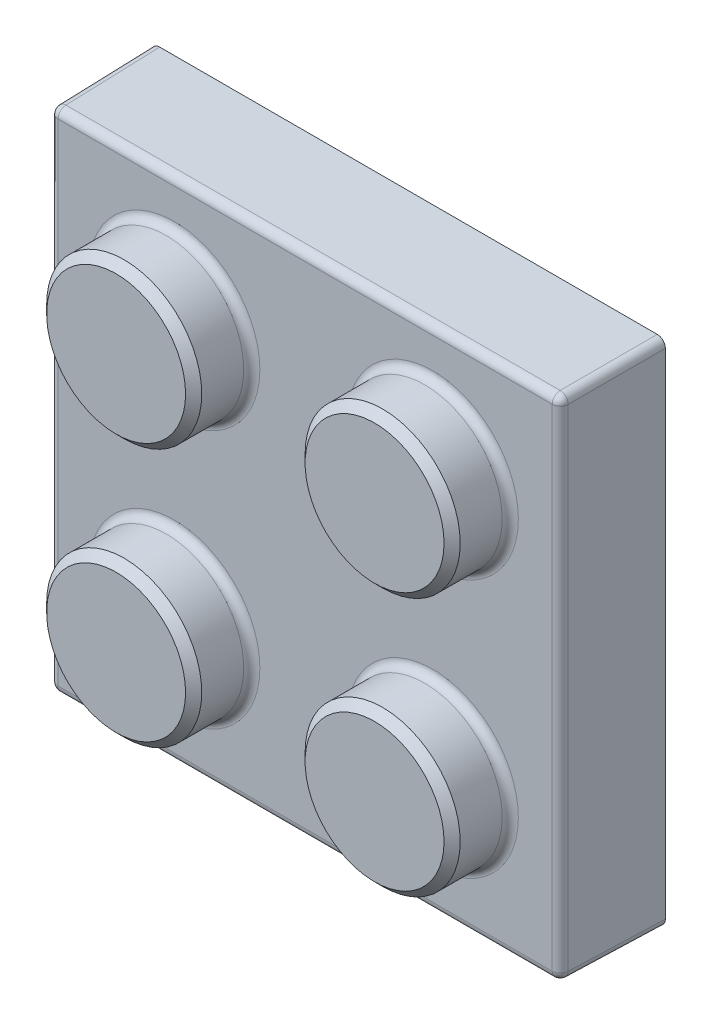
from build123d import *

# Parameters (mm, degrees)
SKETCH1_W                  = 15.9
SKETCH1_H                  = 15.8
BOSS_EXTRUDE1_DEPTH        = 3.2
BOSS_EXTRUDE1_TAPER        = 1
SKETCH2_R                  = 2.4
BOSS_EXTRUDE2_DEPTH        = 1.8
CHAMFER3_SIZE              = 0.25
LPATTERN2_COUNT            = 2
LPATTERN2_PITCH            = 8
LPATTERN2_COUNT_DIR2       = 2
LPATTERN2_PITCH_DIR2       = 8
CHAMFER3_OF_LPATTERN2_SIZE = 0.25
SHELL1_OUTLINE_R           = 1.2
SHELL1_DEPTH               = 3.8
FILLET2_R                  = 0.25


with BuildPart() as part:
    # Sketch1 → Boss-Extrude1 (new body)
    with BuildSketch(Plane.XY):
        Rectangle(SKETCH1_W, SKETCH1_H)
    extrude(amount=BOSS_EXTRUDE1_DEPTH, taper=BOSS_EXTRUDE1_TAPER)

    # Sketch2 → Boss-Extrude2 (add)
    with BuildSketch(Plane.XY.offset(3.2)):
        with Locations(Location((-4.05, -4, 0), (0, 0, 180))):
            Circle(SKETCH2_R)
    boss_extrude2 = extrude(amount=BOSS_EXTRUDE2_DEPTH)

    # Chamfer3
    chamfer3_edges = [part.edges().sort_by_distance(p)[0] for p in [
        (-1.65, -4, 5),
    ]]
    chamfer(chamfer3_edges, length=CHAMFER3_SIZE)

    # LPattern2: Boss-Extrude2 2 × 2
    with Locations(*[(j * LPATTERN2_PITCH_DIR2, i * LPATTERN2_PITCH, 0) for i in range(LPATTERN2_COUNT) for j in range(LPATTERN2_COUNT_DIR2) if (i, j) != (0, 0)]):
        add(boss_extrude2)

    # Chamfer3 of LPattern2
    chamfer3_of_lpattern2_edges = [part.edges().sort_by_distance(p)[0] for p in [
        (6.35, -4, 5),
        (-1.65, 4, 5),
        (6.35, 4, 5),
    ]]
    chamfer(chamfer3_of_lpattern2_edges, length=CHAMFER3_OF_LPATTERN2_SIZE)

    # Shell1: read off the stored shape, not the designer's step
    # Shell1 outline → Shell1 (cut)
    with BuildSketch(Plane.XY):
        with Locations((3.95, 4)):
            Circle(SHELL1_OUTLINE_R)
        with Locations((3.95, -4)):
            Circle(SHELL1_OUTLINE_R)
        with Locations((-4.05, -4)):
            Circle(SHELL1_OUTLINE_R)
        with Locations((-4.05, 4)):
            Circle(SHELL1_OUTLINE_R)
    extrude(amount=SHELL1_DEPTH, mode=Mode.SUBTRACT)

    # Shell1 2: loft between two sections, ruled curve by curve
    shell1_2_from = [
        Edge.make_line((-6.714907076, 6.664907076, 2), (-6.714907076, -6.664907076, 2)),
        Edge.make_line((-6.714907076, -6.664907076, 2), (6.714907076, -6.664907076, 2)),
        Edge.make_line((6.714907076, -6.664907076, 2), (6.714907076, 6.664907076, 2)),
        Edge.make_line((6.714907076, 6.664907076, 2), (-6.714907076, 6.664907076, 2)),
    ]
    shell1_2_to = [
        Edge.make_line((-6.749817206, 6.699817206, 0), (-6.749817206, -6.699817206, 0)),
        Edge.make_line((-6.749817206, -6.699817206, 0), (6.749817206, -6.699817206, 0)),
        Edge.make_line((6.749817206, -6.699817206, 0), (6.749817206, 6.699817206, 0)),
        Edge.make_line((6.749817206, 6.699817206, 0), (-6.749817206, 6.699817206, 0)),
    ]
    shell1_2 = Solid(Shell([*[Face.make_surface_from_curves(shell1_2_from[k], shell1_2_to[k]) for k in range(4)], Face(Wire(shell1_2_from)), Face(Wire(shell1_2_to))]))
    add(shell1_2, mode=Mode.SUBTRACT)

    # Fillet2
    fillet2_edges = [part.edges().sort_by_distance(p)[0] for p in [
        (7.894143792, 0, 3.2),
        (0, 7.844143792, 3.2),
        (-1.65, -4, 3.2),
        (-1.65, 4, 3.2),
        (6.35, -4, 3.2),
        (6.35, 4, 3.2),
        (-7.894143792, 0, 3.2),
        (-7.922071434, 7.872071434, 1.600026465),
        (7.922071896, 7.872071896, 1.6),
        (7.922071434, -7.872071434, 1.600026465),
        (-7.922071896, -7.872071896, 1.6),
        (0, -7.844143792, 3.2),
    ]]
    fillet(fillet2_edges, radius=FILLET2_R)


solid = part.part
